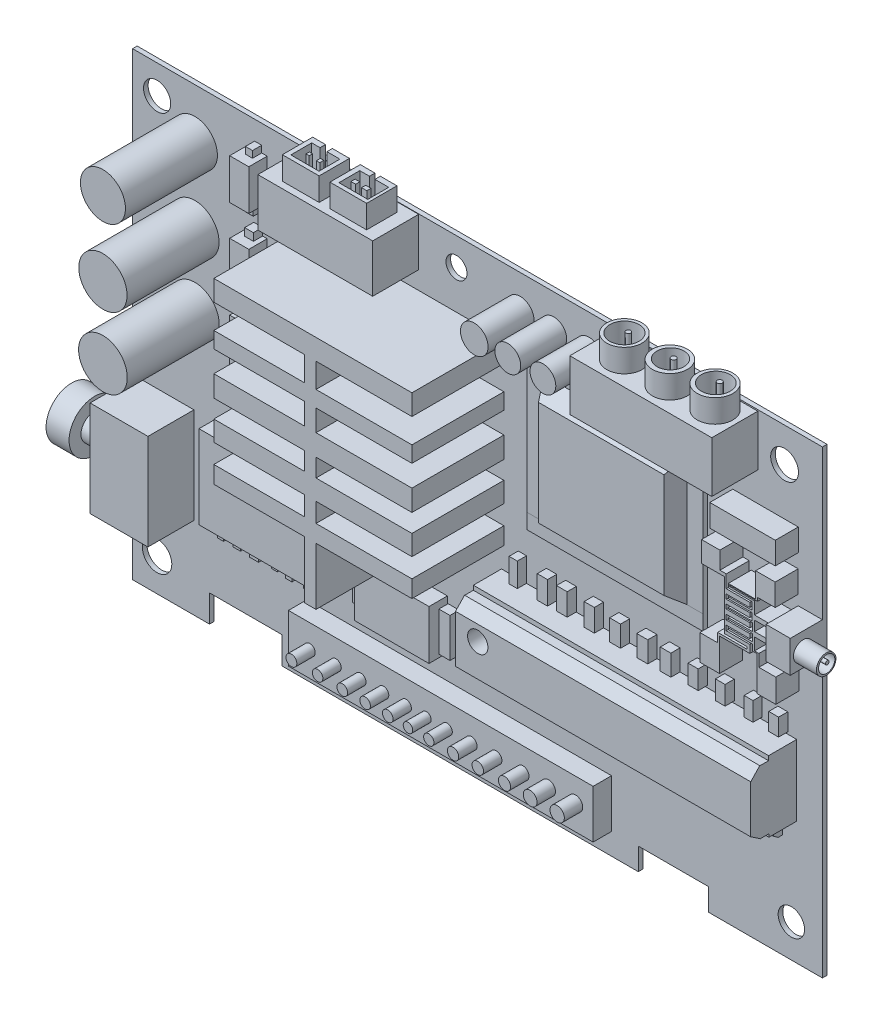
from build123d import *

# Parameters (mm, degrees)
SKETCH1_W              = 150
SKETCH1_H              = 100
BASE_FLANGE1_DEPTH     = 1
BOSS_EXTRUDE1_DEPTH    = 20
SKETCH7_W              = 38.251618342
SKETCH7_H              = 33.405476622
BOSS_EXTRUDE2_DEPTH    = 1
SKETCH20_R             = 4.893913718
SKETCH20_R_2           = 5.251573259
SKETCH20_R_3           = 5.291818848
BOSS_EXTRUDE6_DEPTH    = 20
SKETCH24_W             = 64.192317237
SKETCH24_H             = 15.400590588
BOSS_EXTRUDE8_DEPTH    = 10
CUT_EXTRUDE30_DEPTH    = 155.125892119
CUT_EXTRUDE31_DEPTH    = 70
SKETCH28_W             = 1.829521506
SKETCH28_H             = 1.981017468
CUT_EXTRUDE33_DEPTH    = 155.125892119
SKETCH29_W             = 1.913952811
SKETCH29_H             = 1.907943991
CUT_EXTRUDE34_DEPTH    = 70
SKETCH30_R             = 2.208258319
CUT_EXTRUDE35_DEPTH    = 4
SKETCH31_W             = 15.773922064
SKETCH31_H             = 7.980883473
CUT_EXTRUDE36_DEPTH    = 4
SKETCH32_W             = 15.316742759
SKETCH32_H             = 7.752912661
CUT_EXTRUDE37_DEPTH    = 4
SKETCH33_R             = 3.026227229
CUT_EXTRUDE38_DEPTH    = 4
SKETCH34_R             = 2.94966091
SKETCH34_R_2           = 3.19837787
SKETCH34_R_3           = 2.871285426
CUT_EXTRUDE39_DEPTH    = 4
SKETCH35_W             = 25.995297727
SKETCH35_H             = 18.101056575
BOSS_EXTRUDE9_DEPTH    = 4
SKETCH36_W             = 66.247990623
SKETCH36_H             = 10.503055181
BOSS_EXTRUDE10_DEPTH   = 4
SKETCH37_R             = 1.181265196
SKETCH37_R_2           = 1.148680325
SKETCH37_R_3           = 1.160826502
SKETCH37_R_4           = 1.147015866
SKETCH37_R_5           = 1.033782863
SKETCH37_R_6           = 1.118734734
SKETCH37_R_7           = 1.234131395
SKETCH37_R_8           = 1.248812987
SKETCH37_R_9           = 1.327543916
SKETCH37_R_10          = 1.495383113
SKETCH37_R_11          = 1.557211208
BOSS_EXTRUDE11_DEPTH   = 4
SKETCH38_R             = 2.284411124
CUT_EXTRUDE40_DEPTH    = 4
SKETCH41_W             = 1.375715726
SKETCH41_H             = 2.451416596
BOSS_EXTRUDE12_DEPTH   = 2
SKETCH42_W             = 1.626401118
SKETCH42_H             = 2.461788857
BOSS_EXTRUDE13_DEPTH   = 2
SKETCH43_W             = 1.958242371
SKETCH43_H             = 2.595832426
BOSS_EXTRUDE14_DEPTH   = 2
SKETCH44_W             = 1.307161781
SKETCH44_H             = 3.440066665
BOSS_EXTRUDE15_DEPTH   = 2
SKETCH45_W             = 1.379680109
SKETCH45_H             = 3.07138269
BOSS_EXTRUDE16_DEPTH   = 2
SKETCH46_W             = 1.229332724
SKETCH46_H             = 3.115343909
BOSS_EXTRUDE17_DEPTH   = 2
SKETCH47_W             = 1.427413705
SKETCH47_H             = 2.291843062
BOSS_EXTRUDE18_DEPTH   = 2
SKETCH48_W             = 1.293247009
SKETCH48_H             = 2.149750627
BOSS_EXTRUDE19_DEPTH   = 2
SKETCH49_W             = 1.181554162
SKETCH49_H             = 2.147356577
BOSS_EXTRUDE20_DEPTH   = 2
SKETCH50_W             = 1.044464477
SKETCH50_H             = 2.065160328
BOSS_EXTRUDE21_DEPTH   = 2
SKETCH51_W             = 1.029224977
SKETCH51_H             = 2.03555594
BOSS_EXTRUDE22_DEPTH   = 2
SKETCH52_W             = 1.229200506
SKETCH52_H             = 1.921496808
BOSS_EXTRUDE24_DEPTH   = 2
SKETCH53_W             = 1.112480255
SKETCH53_H             = 1.939294632
BOSS_EXTRUDE25_DEPTH   = 2
SKETCH54_W             = 1.460651109
SKETCH54_H             = 1.9628929
BOSS_EXTRUDE26_DEPTH   = 2
SKETCH55_W             = 2.862023797
SKETCH55_H             = 4.090480276
BOSS_EXTRUDE27_DEPTH   = 2
SKETCH56_W             = 2.013853896
SKETCH56_H             = 4.191456529
SKETCH56_W_2           = 2.414065377
SKETCH56_W_3           = 2.03515958
SKETCH56_W_4           = 2.075413009
SKETCH56_W_5           = 2.49735471
SKETCH56_W_6           = 2.201159214
SKETCH56_H_2           = 4.020421204
SKETCH56_W_7           = 2.258671053
SKETCH56_W_8           = 2.935957611
SKETCH56_W_9           = 2.233644039
SKETCH56_W_10          = 2.248145216
BOSS_EXTRUDE28_DEPTH   = 2
SKETCH57_W             = 2.145937785
SKETCH57_H             = 3.766112071
SKETCH57_W_2           = 1.928839135
SKETCH57_H_2           = 4.09164846
SKETCH57_W_3           = 2.091540081
SKETCH57_W_4           = 2.21160144
SKETCH57_W_5           = 2.308978198
SKETCH57_H_3           = 4.539744881
SKETCH57_W_6           = 2.389169442
SKETCH57_H_4           = 4.547913601
SKETCH57_W_7           = 2.368555189
SKETCH57_H_5           = 4.578489117
SKETCH57_W_8           = 2.225421976
SKETCH57_H_6           = 4.904389855
SKETCH57_W_9           = 2.327276879
SKETCH57_H_7           = 4.797977207
SKETCH57_W_10          = 2.233921941
SKETCH57_H_8           = 5.274749972
SKETCH57_W_11          = 1.792325782
SKETCH57_H_9           = 5.188193424
BOSS_EXTRUDE29_DEPTH   = 2
SKETCH58_W             = 3.061349205
SKETCH58_H             = 1.907791472
SKETCH58_W_2           = 1.986025538
SKETCH58_H_2           = 2.155402711
SKETCH58_W_3           = 2.334649661
SKETCH58_W_4           = 2.149597386
SKETCH58_W_5           = 2.057874793
SKETCH58_W_6           = 2.49493272
SKETCH58_W_7           = 2.221617764
SKETCH58_H_3           = 1.916423675
SKETCH58_W_8           = 2.234745779
SKETCH58_H_4           = 2.236082286
SKETCH58_W_9           = 2.968185876
SKETCH58_H_5           = 2.280175952
SKETCH58_W_10          = 2.22983103
SKETCH58_W_11          = 2.240524801
BOSS_EXTRUDE30_DEPTH   = 2
CUT_EXTRUDE42_DEPTH    = 70
CUT_EXTRUDE43_DEPTH    = 70
SKETCH62_W             = 16.149656918
SKETCH62_H             = 10.730261251
BOSS_EXTRUDE31_DEPTH   = 4
SKETCH63_W             = 4.162884384
SKETCH63_H             = 8.812013171
SKETCH63_H_2           = 9.491073275
SKETCH63_H_3           = 9.653694527
BOSS_EXTRUDE32_DEPTH   = 4
SKETCH64_W             = 1.82396348
SKETCH64_H             = 2.735248808
SKETCH64_W_2           = 1.584314373
SKETCH64_H_2           = 1.452145851
SKETCH64_W_3           = 1.542977073
SKETCH64_H_3           = 1.587751318
SKETCH64_W_4           = 1.911962543
SKETCH64_H_4           = 1.637025818
SKETCH64_W_5           = 1.724683831
SKETCH64_H_5           = 1.851623818
SKETCH64_W_6           = 1.547170171
SKETCH64_H_6           = 1.462342792
BOSS_EXTRUDE33_DEPTH   = 2
SKETCH65_W             = 2.41426032
SKETCH65_H             = 8.495336877
SKETCH65_W_2           = 2.52605134
SKETCH65_H_2           = 8.055999216
BOSS_EXTRUDE34_DEPTH   = 2
SKETCH8_W              = 30.996510459
SKETCH8_H              = 27.675141165
BOSS_EXTRUDE36_DEPTH   = 3
CUT_EXTRUDE45_DEPTH    = 40
CUT_EXTRUDE46_DEPTH    = 40
CUT_EXTRUDE48_DEPTH    = 40
CUT_EXTRUDE50_DEPTH    = 40
SKETCH77_R             = 3.004009085
SKETCH77_R_2           = 2.805559149
SKETCH77_R_3           = 2.801550674
BOSS_EXTRUDE37_DEPTH   = 10
SKETCH78_W             = 12.584258036
SKETCH78_H             = 20.828904369
BOSS_EXTRUDE38_DEPTH   = 10
SKETCH79_R             = 2.853805243
BOSS_EXTRUDE39_DEPTH   = 5
SKETCH80_R             = 5.546791094
BOSS_EXTRUDE40_DEPTH   = 5
SKETCH81_W             = 30.873145794
SKETCH81_H             = 11.064358645
BOSS_EXTRUDE41_DEPTH   = 10
SKETCH82_R             = 3.824680677
SKETCH82_R_2           = 3.814126541
SKETCH82_R_3           = 3.859853746
BOSS_EXTRUDE42_DEPTH   = 5
SKETCH83_R             = 3.171696652
SKETCH83_R_2           = 2.947579381
SKETCH83_R_3           = 3.136464531
CUT_EXTRUDE51_DEPTH    = 5
SKETCH84_R             = 0.502285582
SKETCH84_R_2           = 0.545689285
BOSS_EXTRUDE43_DEPTH   = 5
SKETCH85_W             = 24.967643131
SKETCH85_H             = 10.436014882
BOSS_EXTRUDE44_DEPTH   = 10
BOSS_EXTRUDE45_DEPTH   = 5
BOSS_EXTRUDE45_2_DEPTH = 5
SKETCH86_W             = 0.709261324
SKETCH86_H             = 0.733723682
BOSS_EXTRUDE45_3_DEPTH = 5
SKETCH86_W_2           = 0.754086677
SKETCH86_H_2           = 0.880554305
BOSS_EXTRUDE45_4_DEPTH = 5
SKETCH86_W_3           = 1.028335015
SKETCH86_H_3           = 0.901487711
BOSS_EXTRUDE45_5_DEPTH = 5
SKETCH86_W_4           = 1.14966678
BOSS_EXTRUDE45_6_DEPTH = 5
SKETCH87_W             = 14.238061346
SKETCH87_H             = 4.844821375
BOSS_EXTRUDE46_DEPTH   = 5
BOSS_EXTRUDE47_DEPTH   = 5
SKETCH89_W             = 5.267889795
SKETCH89_H             = 6.968256546
BOSS_EXTRUDE48_DEPTH   = 7
SKETCH90_W             = 4.861947471
SKETCH90_H             = 0.965005398
SKETCH90_W_2           = 4.870076478
SKETCH90_H_2           = 1.002647991
BOSS_EXTRUDE51_DEPTH   = 5
SKETCH91_R             = 2.11936076
BOSS_EXTRUDE52_DEPTH   = 5
SKETCH92_R             = 1.776623795
CUT_EXTRUDE52_DEPTH    = 5
SKETCH93_R             = 0.411844505
BOSS_EXTRUDE53_DEPTH   = 5


# Sheet-metal steps are written as plain solids
with BuildPart() as part:
    # Sketch1 → Base-Flange1 (new body)
    with BuildSketch(Plane.XY):
        Rectangle(SKETCH1_W, SKETCH1_H)
    extrude(amount=-BASE_FLANGE1_DEPTH)

    # Sketch6 → Boss-Extrude1 (add)
    with BuildSketch(Plane.XY):
        Polygon((-17.647750579, 31.094193667), (-17.647750579, 25.768885259), (-37.3337456, 25.768885259), (-37.3337456, 22.28272734), (-17.647750579, 22.28272734), (-17.647750579, 17.622101617), (-37.3337456, 17.622101617), (-37.3337456, 13.026910723), (-17.647750579, 13.026910723), (-17.647750579, 9.091734312), (-37.3337456, 9.091734312), (-37.3337456, 4.705010118), (-17.647750579, 4.705010118), (-17.647750579, 0.536354704), (-37.3337456, 0.536354704), (-37.3337456, -3.191619653), (-17.647750579, -3.191619653), (-17.647750579, -15.655678223), (-15.115535007, -15.655678223), (-15.115535007, -3.191619653), (5.742253828, -3.191619653), (5.742253828, 0.536354704), (-15.115535007, 0.536354704), (-15.115535007, 4.705010118), (5.742253828, 4.705010118), (5.742253828, 9.091734312), (-15.115535007, 9.091734312), (-15.115535007, 13.026910723), (5.742253828, 13.026910723), (5.742253828, 17.622101617), (-15.115535007, 17.622101617), (-15.115535007, 22.28272734), (5.742253828, 22.28272734), (5.742253828, 25.768885259), (-15.115535007, 25.768885259), (-15.115535007, 31.094193667), (5.742253828, 31.094193667), (5.742253828, 35.571913058), (-37.3337456, 35.571913058), (-37.3337456, 31.094193667), align=None)
    extrude(amount=BOSS_EXTRUDE1_DEPTH)

    # Sketch7 → Boss-Extrude2 (add)
    with BuildSketch(Plane.XY):
        with Locations((30.876301757, 19.988298592)):
            Rectangle(SKETCH7_W, SKETCH7_H)
    extrude(amount=BOSS_EXTRUDE2_DEPTH)

    # Sketch20 → Boss-Extrude6 (add)
    with BuildSketch(Plane.XY):
        with Locations((-61.445747498, 39.123272928)):
            Circle(SKETCH20_R)
        with Locations((-61.445747498, 22.944365114)):
            Circle(SKETCH20_R_2)
        with Locations((-61.445747498, 7.478393427)):
            Circle(SKETCH20_R_3)
    extrude(amount=BOSS_EXTRUDE6_DEPTH)

    # Sketch24 → Boss-Extrude8 (add)
    with BuildSketch(Plane.XY):
        with Locations((37.315719775, -15.564442532)):
            Rectangle(SKETCH24_W, SKETCH24_H)
    extrude(amount=BOSS_EXTRUDE8_DEPTH)

    # Sketch25 → Cut-Extrude30 (cut, through all)
    with BuildSketch(Plane(origin=(69.411878394, 0, 0), x_dir=(0, 0, -1), z_dir=(1, 0, 0))):
        Polygon((-6.95948185, -23.264737826), (-10, -21.210215597), (-10.383799283, -21.210215597), (-13.173179255, -25.338260702), align=None)
    extrude(amount=-CUT_EXTRUDE30_DEPTH, mode=Mode.SUBTRACT)

    # Sketch26 → Cut-Extrude31 (cut)
    with BuildSketch(Plane(origin=(69.411878394, 0, 0), x_dir=(0, 0, -1), z_dir=(1, 0, 0))):
        Polygon((-7.157587152, -7.864147238), (-10, -10.846715803), (-12.149574274, -7.378868006), align=None)
    extrude(amount=-CUT_EXTRUDE31_DEPTH, mode=Mode.SUBTRACT)

    # Sketch28 → Cut-Extrude33 (cut, through all)
    with BuildSketch(Plane(origin=(69.411878394, 0, 0), x_dir=(0, 0, -1), z_dir=(1, 0, 0))):
        with Locations((-6.95948185, -23.596243063)):
            Rectangle(SKETCH28_W, SKETCH28_H)
    extrude(amount=-CUT_EXTRUDE33_DEPTH, mode=Mode.SUBTRACT)

    # Sketch29 → Cut-Extrude34 (cut)
    with BuildSketch(Plane(origin=(69.411878394, 0, 0), x_dir=(0, 0, -1), z_dir=(1, 0, 0))):
        with Locations((-7.07856122, -7.864147238)):
            Rectangle(SKETCH29_W, SKETCH29_H)
    extrude(amount=-CUT_EXTRUDE34_DEPTH, mode=Mode.SUBTRACT)

    # Sketch30 → Cut-Extrude35 (cut)
    with BuildSketch(Plane.XY.offset(10)):
        with Locations((10.059798535, -14.15654171)):
            Circle(SKETCH30_R)
    extrude(amount=-CUT_EXTRUDE35_DEPTH, mode=Mode.SUBTRACT)

    # Sketch31 → Cut-Extrude36 (cut)
    with BuildSketch(Plane.XY):
        with Locations((-50.382765947, -48.096382801)):
            Rectangle(SKETCH31_W, SKETCH31_H)
    extrude(amount=-CUT_EXTRUDE36_DEPTH, mode=Mode.SUBTRACT)

    # Sketch32 → Cut-Extrude37 (cut)
    with BuildSketch(Plane.XY):
        with Locations((42.623404519, -49.055562996)):
            Rectangle(SKETCH32_W, SKETCH32_H)
    extrude(amount=-CUT_EXTRUDE37_DEPTH, mode=Mode.SUBTRACT)

    # Sketch33 → Cut-Extrude38 (cut)
    with BuildSketch(Plane.XY):
        with Locations((66.770748421, 42.592540068)):
            Circle(SKETCH33_R)
    extrude(amount=-CUT_EXTRUDE38_DEPTH, mode=Mode.SUBTRACT)

    # Sketch34 → Cut-Extrude39 (cut)
    with BuildSketch(Plane.XY):
        with Locations((-69.666143344, 43.767302707)):
            Circle(SKETCH34_R)
        with Locations((-69.666143344, -42.810509177)):
            Circle(SKETCH34_R_2)
        with Locations((68.245145494, -42.810509177)):
            Circle(SKETCH34_R_3)
    extrude(amount=-CUT_EXTRUDE39_DEPTH, mode=Mode.SUBTRACT)

    # Sketch35 → Boss-Extrude9 (add)
    with BuildSketch(Plane.XY):
        with Locations((-43.558798458, -19.388431916)):
            Rectangle(SKETCH35_W, SKETCH35_H)
    extrude(amount=BOSS_EXTRUDE9_DEPTH)

    # Sketch36 → Boss-Extrude10 (add)
    with BuildSketch(Plane.XY):
        with Locations((-3.980345024, -40.083616171)):
            Rectangle(SKETCH36_W, SKETCH36_H)
    extrude(amount=BOSS_EXTRUDE10_DEPTH)

    # Sketch37 → Boss-Extrude11 (add)
    with BuildSketch(Plane.XY.offset(4)):
        with Locations((-32.461773453, -39.922141762)):
            Circle(SKETCH37_R)
        with Locations((-26.768920114, -39.922141762)):
            Circle(SKETCH37_R_2)
        with Locations((-21.391562505, -39.922141762)):
            Circle(SKETCH37_R_3)
        with Locations((-16.432461651, -39.922141762)):
            Circle(SKETCH37_R_4)
        with Locations((-11.514578285, -39.922141762)):
            Circle(SKETCH37_R_4)
        with Locations((-7.111969395, -39.922141762)):
            Circle(SKETCH37_R_5)
        with Locations((-2.592262692, -39.922141762)):
            Circle(SKETCH37_R_6)
        with Locations((2.686057552, -39.922141762)):
            Circle(SKETCH37_R_7)
        with Locations((8.058652609, -39.922141762)):
            Circle(SKETCH37_R_8)
        with Locations((13.87803858, -39.922141762)):
            Circle(SKETCH37_R_9)
        with Locations((19.454436288, -39.922141762)):
            Circle(SKETCH37_R_10)
        with Locations((25.32464073, -39.922141762)):
            Circle(SKETCH37_R_11)
    extrude(amount=BOSS_EXTRUDE11_DEPTH)

    # Sketch38 → Cut-Extrude40 (cut)
    with BuildSketch(Plane.XY):
        with Locations((-4.570119234, 44.001544941)):
            Circle(SKETCH38_R)
    extrude(amount=-CUT_EXTRUDE40_DEPTH, mode=Mode.SUBTRACT)

    # Sketch41 → Boss-Extrude12 (add)
    with BuildSketch(Plane(origin=(0, -28.438960203, 0), x_dir=(-1, 0, 0), z_dir=(0, -1, 0))):
        with Locations((53.441447581, -1.225708298)):
            Rectangle(SKETCH41_W, SKETCH41_H)
    extrude(amount=BOSS_EXTRUDE12_DEPTH)

    # Sketch42 → Boss-Extrude13 (add)
    with BuildSketch(Plane(origin=(0, -28.438960203, 0), x_dir=(-1, 0, 0), z_dir=(0, -1, 0))):
        with Locations((49.882089405, -1.230894429)):
            Rectangle(SKETCH42_W, SKETCH42_H)
    extrude(amount=BOSS_EXTRUDE13_DEPTH)

    # Sketch43 → Boss-Extrude14 (add)
    with BuildSketch(Plane(origin=(0, -28.438960203, 0), x_dir=(-1, 0, 0), z_dir=(0, -1, 0))):
        with Locations((45.973423436, -1.297916213)):
            Rectangle(SKETCH43_W, SKETCH43_H)
    extrude(amount=BOSS_EXTRUDE14_DEPTH)

    # Sketch44 → Boss-Extrude15 (add)
    with BuildSketch(Plane(origin=(0, -28.438960203, 0), x_dir=(-1, 0, 0), z_dir=(0, -1, 0))):
        with Locations((41.827286179, -0.628457698)):
            Rectangle(SKETCH44_W, SKETCH44_H)
    extrude(amount=BOSS_EXTRUDE15_DEPTH)

    # Sketch45 → Boss-Extrude16 (add)
    with BuildSketch(Plane(origin=(0, -28.438960203, 0), x_dir=(-1, 0, 0), z_dir=(0, -1, 0))):
        with Locations((38.372398816, -1.129560262)):
            Rectangle(SKETCH45_W, SKETCH45_H)
    extrude(amount=BOSS_EXTRUDE16_DEPTH)

    # Sketch46 → Boss-Extrude17 (add)
    with BuildSketch(Plane(origin=(0, -28.438960203, 0), x_dir=(-1, 0, 0), z_dir=(0, -1, 0))):
        with Locations((34.656178331, -1.024237824)):
            Rectangle(SKETCH46_W, SKETCH46_H)
    extrude(amount=BOSS_EXTRUDE17_DEPTH)

    # Sketch47 → Boss-Extrude18 (add)
    with BuildSketch(Plane(origin=(0, -10.337903628, 0), x_dir=(1, 0, 0), z_dir=(0, 1, 0))):
        with Locations((-53.086628292, -1.145921531)):
            Rectangle(SKETCH47_W, SKETCH47_H)
    extrude(amount=BOSS_EXTRUDE18_DEPTH)

    # Sketch48 → Boss-Extrude19 (add)
    with BuildSketch(Plane(origin=(0, -10.337903628, 0), x_dir=(1, 0, 0), z_dir=(0, 1, 0))):
        with Locations((-49.855259062, -1.074875313)):
            Rectangle(SKETCH48_W, SKETCH48_H)
    extrude(amount=BOSS_EXTRUDE19_DEPTH)

    # Sketch49 → Boss-Extrude20 (add)
    with BuildSketch(Plane(origin=(0, -10.337903628, 0), x_dir=(1, 0, 0), z_dir=(0, 1, 0))):
        with Locations((-46.61660723, -1.073678289)):
            Rectangle(SKETCH49_W, SKETCH49_H)
    extrude(amount=BOSS_EXTRUDE20_DEPTH)

    # Sketch50 → Boss-Extrude21 (add)
    with BuildSketch(Plane(origin=(0, -10.337903628, 0), x_dir=(1, 0, 0), z_dir=(0, 1, 0))):
        with Locations((-43.679284061, -0.887375897)):
            Rectangle(SKETCH50_W, SKETCH50_H)
    extrude(amount=BOSS_EXTRUDE21_DEPTH)

    # Sketch51 → Boss-Extrude22 (add)
    with BuildSketch(Plane(origin=(0, -10.337903628, 0), x_dir=(1, 0, 0), z_dir=(0, 1, 0))):
        with Locations((-41.085941594, -0.915066637)):
            Rectangle(SKETCH51_W, SKETCH51_H)
    extrude(amount=BOSS_EXTRUDE22_DEPTH)

    # Sketch52 → Boss-Extrude24 (add)
    with BuildSketch(Plane.XY):
        with Locations((-38.491139911, -9.334604882)):
            Rectangle(SKETCH52_W, SKETCH52_H)
    extrude(amount=BOSS_EXTRUDE24_DEPTH)

    # Sketch53 → Boss-Extrude25 (add)
    with BuildSketch(Plane.XY):
        with Locations((-35.985401094, -9.471766755)):
            Rectangle(SKETCH53_W, SKETCH53_H)
    extrude(amount=BOSS_EXTRUDE25_DEPTH)

    # Sketch54 → Boss-Extrude26 (add)
    with BuildSketch(Plane.XY):
        with Locations((-32.796721328, -9.424908257)):
            Rectangle(SKETCH54_W, SKETCH54_H)
    extrude(amount=BOSS_EXTRUDE26_DEPTH)

    # Sketch55 → Boss-Extrude27 (add)
    with BuildSketch(Plane.XY):
        with Locations((9.4679968, -25.439262963)):
            Rectangle(SKETCH55_W, SKETCH55_H)
    extrude(amount=BOSS_EXTRUDE27_DEPTH)

    # Sketch56 → Boss-Extrude28 (add)
    with BuildSketch(Plane.XY):
        with Locations((15.930871519, -25.052037167)):
            Rectangle(SKETCH56_W, SKETCH56_H)
        with Locations((21.299661032, -25.052037167)):
            Rectangle(SKETCH56_W_2, SKETCH56_H)
        with Locations((26.145432754, -25.052037167)):
            Rectangle(SKETCH56_W_3, SKETCH56_H)
        with Locations((31.479211629, -25.052037167)):
            Rectangle(SKETCH56_W_4, SKETCH56_H)
        with Locations((36.292401806, -25.052037167)):
            Rectangle(SKETCH56_W_5, SKETCH56_H)
        with Locations((41.623450192, -25.329015551)):
            Rectangle(SKETCH56_W_6, SKETCH56_H_2)
        with Locations((47.47250203, -25.329015551)):
            Rectangle(SKETCH56_W_7, SKETCH56_H_2)
        with Locations((53.595229455, -25.329015551)):
            Rectangle(SKETCH56_W_8, SKETCH56_H_2)
        with Locations((59.694041926, -25.329015551)):
            Rectangle(SKETCH56_W_9, SKETCH56_H_2)
        with Locations((65.248987414, -25.329015551)):
            Rectangle(SKETCH56_W_10, SKETCH56_H_2)
    extrude(amount=BOSS_EXTRUDE28_DEPTH)

    # Sketch57 → Boss-Extrude29 (add)
    with BuildSketch(Plane.XY):
        with Locations((66.399242935, -5.520789868)):
            Rectangle(SKETCH57_W, SKETCH57_H)
        with Locations((60.943696913, -5.351478881)):
            Rectangle(SKETCH57_W_2, SKETCH57_H_2)
        with Locations((54.785557878, -5.351478881)):
            Rectangle(SKETCH57_W_3, SKETCH57_H_2)
        with Locations((48.883573918, -5.351478881)):
            Rectangle(SKETCH57_W_4, SKETCH57_H_2)
        with Locations((42.889723965, -5.575527091)):
            Rectangle(SKETCH57_W_5, SKETCH57_H_3)
        with Locations((37.826934409, -5.579611451)):
            Rectangle(SKETCH57_W_6, SKETCH57_H_4)
        with Locations((31.917946403, -5.59489921)):
            Rectangle(SKETCH57_W_7, SKETCH57_H_5)
        with Locations((26.295878957, -5.467821004)):
            Rectangle(SKETCH57_W_8, SKETCH57_H_6)
        with Locations((20.333553309, -5.41461468)):
            Rectangle(SKETCH57_W_9, SKETCH57_H_7)
        with Locations((16.106794882, -5.498967499)):
            Rectangle(SKETCH57_W_10, SKETCH57_H_8)
        with Locations((9.759089575, -5.258873143)):
            Rectangle(SKETCH57_W_11, SKETCH57_H_9)
    extrude(amount=BOSS_EXTRUDE29_DEPTH)

    # Sketch58 → Boss-Extrude30 (add)
    with BuildSketch(Plane.XY.offset(2)):
        with Locations((9.368334096, -24.287447968)):
            Rectangle(SKETCH58_W, SKETCH58_H)
        with Locations((15.935025298, -24.361561608)):
            Rectangle(SKETCH58_W_2, SKETCH58_H_2)
        with Locations((21.316704376, -24.361561608)):
            Rectangle(SKETCH58_W_3, SKETCH58_H_2)
        with Locations((26.088213851, -24.361561608)):
            Rectangle(SKETCH58_W_4, SKETCH58_H_2)
        with Locations((31.498824348, -24.361561608)):
            Rectangle(SKETCH58_W_5, SKETCH58_H_2)
        with Locations((36.293612801, -24.361561608)):
            Rectangle(SKETCH58_W_6, SKETCH58_H_2)
        with Locations((41.640508169, -24.32122182)):
            Rectangle(SKETCH58_W_7, SKETCH58_H_3)
        with Locations((47.484464667, -24.32122182)):
            Rectangle(SKETCH58_W_8, SKETCH58_H_4)
        with Locations((53.579115322, -24.504832935)):
            Rectangle(SKETCH58_W_9, SKETCH58_H_5)
        with Locations((59.69594843, -24.504832935)):
            Rectangle(SKETCH58_W_10, SKETCH58_H_5)
        with Locations((65.248383795, -24.504832935)):
            Rectangle(SKETCH58_W_11, SKETCH58_H_5)
    extrude(amount=BOSS_EXTRUDE30_DEPTH)

    # Sketch59 → Cut-Extrude42 (cut)
    with BuildSketch(Plane(origin=(66.368646195, 0, 0), x_dir=(0, 0, -1), z_dir=(1, 0, 0))):
        Polygon((-3.167794698, -25.644920911), (-4.471121941, -24.30317603), (-5.017719762, -26.218189345), align=None)
    extrude(amount=-CUT_EXTRUDE42_DEPTH, mode=Mode.SUBTRACT)

    # Sketch60 → Cut-Extrude43 (cut)
    with BuildSketch(Plane(origin=(66.373060022, 0, 0), x_dir=(0, 0, -1), z_dir=(1, 0, 0))):
        Polygon((-1, -27.339226153), (-2.440588327, -26.329263207), (-3.771198576, -27.550219069), (-3.51386615, -28.551200696), align=None)
    extrude(amount=-CUT_EXTRUDE43_DEPTH, mode=Mode.SUBTRACT)

    # Sketch62 → Boss-Extrude31 (add)
    with BuildSketch(Plane.XY):
        with Locations((-14.622272799, -24.190447402)):
            Rectangle(SKETCH62_W, SKETCH62_H)
    extrude(amount=BOSS_EXTRUDE31_DEPTH)

    # Sketch63 → Boss-Extrude32 (add)
    with BuildSketch(Plane.XY):
        with Locations((-47.807181002, 39.992576914)):
            Rectangle(SKETCH63_W, SKETCH63_H)
        with Locations((-47.807181002, 24.105594053)):
            Rectangle(SKETCH63_W, SKETCH63_H_2)
        with Locations((-47.807181002, 9.560017977)):
            Rectangle(SKETCH63_W, SKETCH63_H_3)
    extrude(amount=BOSS_EXTRUDE32_DEPTH)

    # Sketch64 → Boss-Extrude33 (add)
    with BuildSketch(Plane.XY):
        with Locations((-47.69029113, 3.192077187)):
            Rectangle(SKETCH64_W, SKETCH64_H)
        with Locations((-47.697382873, 15.112938167)):
            Rectangle(SKETCH64_W_2, SKETCH64_H_2)
        with Locations((-47.718051523, 18.409225297)):
            Rectangle(SKETCH64_W_3, SKETCH64_H_3)
        with Locations((-47.67958854, 29.669643599)):
            Rectangle(SKETCH64_W_4, SKETCH64_H_4)
        with Locations((-47.627198144, 34.475192921)):
            Rectangle(SKETCH64_W_5, SKETCH64_H_5)
        with Locations((-47.68892671, 45.129754895)):
            Rectangle(SKETCH64_W_6, SKETCH64_H_6)
    extrude(amount=BOSS_EXTRUDE33_DEPTH)

    # Sketch65 → Boss-Extrude34 (add)
    with BuildSketch(Plane.XY):
        with Locations((-5.186216329, -24.464382883)):
            Rectangle(SKETCH65_W, SKETCH65_H)
        with Locations((-23.922749004, -24.333427924)):
            Rectangle(SKETCH65_W_2, SKETCH65_H_2)
    extrude(amount=BOSS_EXTRUDE34_DEPTH)

    # Sketch8 → Boss-Extrude36 (add)
    with BuildSketch(Plane.XY.offset(1)):
        with Locations((31.012732639, 20.418844431)):
            Rectangle(SKETCH8_W, SKETCH8_H)
    extrude(amount=BOSS_EXTRUDE36_DEPTH)

    # Sketch72 → Cut-Extrude45 (cut)
    with BuildSketch(Plane(origin=(46.510987868, 0, 0), x_dir=(0, 0, -1), z_dir=(1, 0, 0))):
        Polygon((-4, 31.530886191), (-1, 34.256415013), (-4.945790408, 35.585741459), align=None)
    extrude(amount=-CUT_EXTRUDE45_DEPTH, mode=Mode.SUBTRACT)

    # Sketch73 → Cut-Extrude46 (cut)
    with BuildSketch(Plane(origin=(0, 6.581273848, 0), x_dir=(-1, 0, 0), z_dir=(0, -1, 0))):
        Polygon((-15.514477409, -1.110503972), (-17.778151425, -4.856238075), (-12.911077218, -5.38954298), align=None)
    extrude(amount=-CUT_EXTRUDE46_DEPTH, mode=Mode.SUBTRACT)

    # Sketch74 → Cut-Extrude48 (cut)
    with BuildSketch(Plane(origin=(0, 6.581273848, 0), x_dir=(-1, 0, 0), z_dir=(0, -1, 0))):
        Polygon((-46.510987868, -1), (-44.021403155, -4.779249321), (-47.858197998, -5.394597483), align=None)
    extrude(amount=-CUT_EXTRUDE48_DEPTH, mode=Mode.SUBTRACT)

    # Sketch76 → Cut-Extrude50 (cut)
    with BuildSketch(Plane(origin=(50.002110928, 0, 0), x_dir=(0, 0, -1), z_dir=(1, 0, 0))):
        Polygon((-1, 6.580298979), (-7.367230248, 11.297984555), (-7.498473278, 2.861320449), align=None)
    extrude(amount=-CUT_EXTRUDE50_DEPTH, mode=Mode.SUBTRACT)

    # Sketch77 → Boss-Extrude37 (add)
    with BuildSketch(Plane.XY):
        with Locations((9.297078398, 42.493905164)):
            Circle(SKETCH77_R)
        with Locations((16.590462577, 42.493905164)):
            Circle(SKETCH77_R_2)
        with Locations((24.224659102, 42.493905164)):
            Circle(SKETCH77_R_3)
    extrude(amount=BOSS_EXTRUDE37_DEPTH)

    # Sketch78 → Boss-Extrude38 (add)
    with BuildSketch(Plane.XY):
        with Locations((-67.947615077, -21.750910019)):
            Rectangle(SKETCH78_W, SKETCH78_H)
    extrude(amount=BOSS_EXTRUDE38_DEPTH)

    # Sketch79 → Boss-Extrude39 (add)
    with BuildSketch(Plane.ZY.offset(74.239744095)):
        with Locations(Location((4.12542822, -21.269303498, 0), (0, 0, 180))):
            Circle(SKETCH79_R)
    extrude(amount=BOSS_EXTRUDE39_DEPTH)

    # Sketch80 → Boss-Extrude40 (add)
    with BuildSketch(Plane.ZY.offset(79.239744095)):
        with Locations((4.018946024, -21.117611334)):
            Circle(SKETCH80_R)
    extrude(amount=BOSS_EXTRUDE40_DEPTH)

    # Sketch81 → Boss-Extrude41 (add)
    with BuildSketch(Plane.XY):
        with Locations((45.509863349, 44.176828044)):
            Rectangle(SKETCH81_W, SKETCH81_H)
    extrude(amount=BOSS_EXTRUDE41_DEPTH)

    # Sketch82 → Boss-Extrude42 (add)
    with BuildSketch(Plane(origin=(0, 49.709007367, 0), x_dir=(1, 0, 0), z_dir=(0, 1, 0))):
        with Locations(Location((36.716183498, -4.776881935, 0), (0, 0, 90))):
            Circle(SKETCH82_R)
        with Locations(Location((46.604893109, -4.776881935, 0), (0, 0, 90))):
            Circle(SKETCH82_R_2)
        with Locations(Location((56.037781084, -4.384450973, 0), (0, 0, 90))):
            Circle(SKETCH82_R_3)
    extrude(amount=BOSS_EXTRUDE42_DEPTH)

    # Sketch83 → Cut-Extrude51 (cut)
    with BuildSketch(Plane(origin=(0, 54.709007367, 0), x_dir=(1, 0, 0), z_dir=(0, 1, 0))):
        with Locations(Location((36.708189876, -4.75977211, 0), (0, 0, 270))):
            Circle(SKETCH83_R)
        with Locations(Location((46.604172538, -4.636113403, 0), (0, 0, 270))):
            Circle(SKETCH83_R_2)
        with Locations(Location((56.062486485, -4.24738544, 0), (0, 0, 270))):
            Circle(SKETCH83_R_3)
    extrude(amount=-CUT_EXTRUDE51_DEPTH, mode=Mode.SUBTRACT)

    # Sketch84 → Boss-Extrude43 (add)
    with BuildSketch(Plane(origin=(0, 49.709007367, 0), x_dir=(1, 0, 0), z_dir=(0, 1, 0))):
        with Locations(Location((36.923896569, -4.118579155, 0), (0, 0, 270))):
            Circle(SKETCH84_R)
        with Locations(Location((46.77719016, -4.118579155, 0), (0, 0, 270))):
            Circle(SKETCH84_R_2)
        with Locations(Location((56.246976071, -3.572889871, 0), (0, 0, 270))):
            Circle(SKETCH84_R_2)
    extrude(amount=BOSS_EXTRUDE43_DEPTH)

    # Sketch85 → Boss-Extrude44 (add)
    with BuildSketch(Plane.XY):
        with Locations((-25.273782502, 44.691053919)):
            Rectangle(SKETCH85_W, SKETCH85_H)
    extrude(amount=BOSS_EXTRUDE44_DEPTH)

    # Sketch87 → Boss-Extrude46 (add)
    with BuildSketch(Plane.XY):
        with Locations((62.626482103, 29.882058108)):
            Rectangle(SKETCH87_W, SKETCH87_H)
    extrude(amount=BOSS_EXTRUDE46_DEPTH)

    # Sketch88 → Boss-Extrude47 (add)
    with BuildSketch(Plane.XY):
        Polygon((57.703570751, 19.917001172), (58.759131552, 19.959814948), (58.759131552, 9.20469279), (63.649557877, 9.20469279), (63.649557877, 8.701073222), (57.218362821, 8.701073222), (57.218362821, 6.736029216), (53.350150218, 6.736029216), (53.350150218, 1.136260539), (57.614259637, 1.136260539), (57.614259637, 6.736029216), (57.614259637, 8.219096904), (64.213881374, 8.219096904), (64.213881374, 9.20469279), (64.213881374, 9.924979696), (59.086246107, 9.924979696), (59.086246107, 10.989022176), (64.213881374, 10.989022176), (64.213881374, 11.957054771), (59.086246107, 11.957054771), (59.086246107, 13.035748433), (64.213881374, 13.035748433), (64.213881374, 14.017333139), (59.086246107, 14.017333139), (59.086246107, 14.958261512), (64.213881374, 14.958261512), (64.213881374, 15.873946461), (59.086246107, 15.873946461), (59.086246107, 16.86420305), (64.213881374, 16.86420305), (64.213881374, 17.848061162), (59.086246107, 17.848061162), (59.086246107, 20.639878772), (57.703570751, 20.639878772), (57.703570751, 24.425200354), (53.715705012, 24.425200354), (53.715705012, 19.917001172), align=None)
        Polygon((65.478638861, 24.425200354), (69.73508729, 24.425200354), (69.73508729, 19.617969664), (65.877586928, 19.617969664), (65.877586928, 18.870305367), (59.838126727, 18.870305367), (59.838126727, 18.643621012), (65.226138664, 18.643621012), (65.226138664, 9.20469279), (66.179474375, 9.20469279), (66.179474375, 6.592543265), (69.856435126, 6.592543265), (69.856435126, 1.446430177), (65.737983896, 1.446430177), (65.737983896, 6.592543265), (65.737983896, 8.959407408), (64.830296812, 8.959407408), (64.830296812, 10.256888594), (59.525089321, 10.312318283), (59.525089321, 10.719912384), (64.830296812, 10.719912384), (64.830296812, 12.263047517), (59.525089321, 12.263047517), (59.525089321, 12.631816106), (64.746673305, 12.631816106), (64.746673305, 14.299533963), (59.525089321, 14.299533963), (59.525089321, 14.57526809), (64.698252732, 14.57526809), (64.698252732, 16.1657427), (59.525089321, 16.1657427), (59.525089321, 16.610270477), (64.659998451, 16.610270477), (64.659998451, 18.223173763), (59.525089321, 18.223173763), (59.525089321, 18.643621012), (59.525089321, 19.066847527), (65.478638861, 19.066847527), (65.478638861, 19.617969664), align=None)
    extrude(amount=BOSS_EXTRUDE47_DEPTH)

    # Sketch89 → Boss-Extrude48 (add)
    with BuildSketch(Plane.XY):
        with Locations((72.366055102, 13.971541993)):
            Rectangle(SKETCH89_W, SKETCH89_H)
    extrude(amount=BOSS_EXTRUDE48_DEPTH)

    # Sketch90 → Boss-Extrude51 (add)
    with BuildSketch(Plane.XY.offset(5)):
        with Locations((67.607313917, 15.489227949)):
            Rectangle(SKETCH90_W, SKETCH90_H)
        with Locations((67.562267283, 12.341859138)):
            Rectangle(SKETCH90_W_2, SKETCH90_H_2)
    extrude(amount=-BOSS_EXTRUDE51_DEPTH)

    # Sketch91 → Boss-Extrude52 (add)
    with BuildSketch(Plane(origin=(75, 0, 0), x_dir=(0, 0, -1), z_dir=(1, 0, 0))):
        with Locations((-4.183985433, 13.678902134)):
            Circle(SKETCH91_R)
    extrude(amount=BOSS_EXTRUDE52_DEPTH)

    # Sketch92 → Cut-Extrude52 (cut)
    with BuildSketch(Plane(origin=(80, 0, 0), x_dir=(0, 0, -1), z_dir=(1, 0, 0))):
        with Locations((-4.071081746, 13.679707869)):
            Circle(SKETCH92_R)
    extrude(amount=-CUT_EXTRUDE52_DEPTH, mode=Mode.SUBTRACT)

    # Sketch93 → Boss-Extrude53 (add)
    with BuildSketch(Plane(origin=(75, 0, 0), x_dir=(0, 0, -1), z_dir=(1, 0, 0))):
        with Locations((-3.934464431, 13.860683088)):
            Circle(SKETCH93_R)
    extrude(amount=BOSS_EXTRUDE53_DEPTH)


with BuildPart() as body_2:
    # Sketch86 → Boss-Extrude45 (new body)
    with BuildSketch(Plane(origin=(0, 49.90906136, 0), x_dir=(1, 0, 0), z_dir=(0, 1, 0))):
        Polygon((-31.057280519, -1.986768901), (-31.057280519, -3.172058882), (-32.877680306, -3.172058882), (-32.877680306, -7.71434916), (-26.7469106, -7.71434916), (-26.7469106, -3.172058882), (-29.568749159, -3.172058882), (-29.568749159, -1.986768901), (-25.849100624, -1.986768901), (-25.849100624, -8.586898932), (-33.841826382, -8.586898932), (-33.841826382, -1.986768901), align=None)
    extrude(amount=BOSS_EXTRUDE45_DEPTH)


with BuildPart() as body_3:
    # Sketch86 → Boss-Extrude45 2 (new body)
    with BuildSketch(Plane(origin=(0, 49.90906136, 0), x_dir=(1, 0, 0), z_dir=(0, 1, 0))):
        Polygon((-23.503721383, -1.986768901), (-20.308382727, -1.986768901), (-20.308382727, -3.172058882), (-22.420085542, -3.172058882), (-22.420085542, -7.71434916), (-16.133751155, -7.71434916), (-16.133751155, -3.172058882), (-19.138599128, -3.172058882), (-19.138599128, -1.986768901), (-15.524196726, -1.986768901), (-15.524196726, -8.586898932), (-23.503721383, -8.586898932), align=None)
    extrude(amount=BOSS_EXTRUDE45_2_DEPTH)


with BuildPart() as body_4:
    # Sketch86 → Boss-Extrude45 3 (new body)
    with BuildSketch(Plane(origin=(0, 49.90906136, 0), x_dir=(1, 0, 0), z_dir=(0, 1, 0))):
        with Locations((-31.070390331, -5.510551069)):
            Rectangle(SKETCH86_W, SKETCH86_H)
    extrude(amount=BOSS_EXTRUDE45_3_DEPTH)


with BuildPart() as body_5:
    # Sketch86 → Boss-Extrude45 4 (new body)
    with BuildSketch(Plane(origin=(0, 49.90906136, 0), x_dir=(1, 0, 0), z_dir=(0, 1, 0))):
        with Locations((-28.645271588, -5.583966381)):
            Rectangle(SKETCH86_W_2, SKETCH86_H_2)
    extrude(amount=BOSS_EXTRUDE45_4_DEPTH)


with BuildPart() as body_6:
    # Sketch86 → Boss-Extrude45 5 (new body)
    with BuildSketch(Plane(origin=(0, 49.90906136, 0), x_dir=(1, 0, 0), z_dir=(0, 1, 0))):
        with Locations((-20.822550234, -5.737577771)):
            Rectangle(SKETCH86_W_3, SKETCH86_H_3)
    extrude(amount=BOSS_EXTRUDE45_5_DEPTH)


with BuildPart() as body_7:
    # Sketch86 → Boss-Extrude45 6 (new body)
    with BuildSketch(Plane(origin=(0, 49.90906136, 0), x_dir=(1, 0, 0), z_dir=(0, 1, 0))):
        with Locations((-18.45412521, -5.737577771)):
            Rectangle(SKETCH86_W_4, SKETCH86_H_3)
    extrude(amount=BOSS_EXTRUDE45_6_DEPTH)


solid = Compound([part.part, body_2.part, body_3.part, body_4.part, body_5.part, body_6.part, body_7.part])
